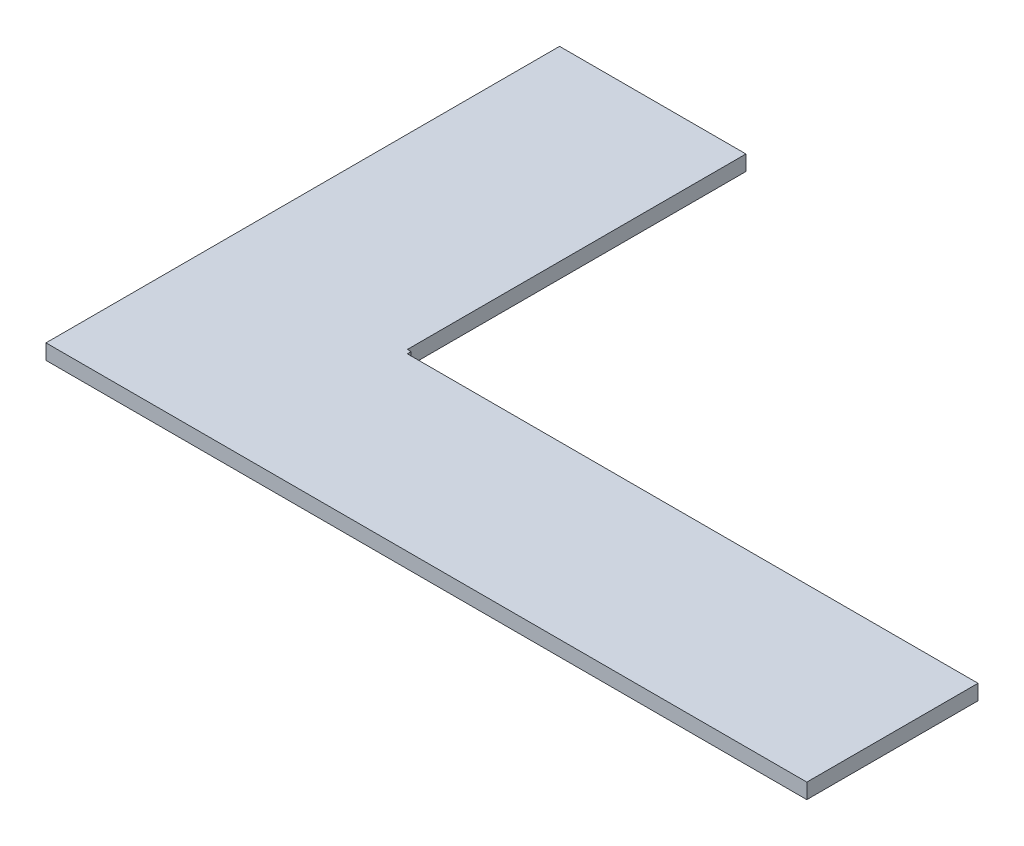
from build123d import *

# Parameters (mm, degrees)
STOCK_2D1LAYER_1_START       = -45
STOCK_2D1LAYER_1_OUTLINE_W   = 200
STOCK_2D1LAYER_1_OUTLINE_H   = 4
STOCK_2D1LAYER_1_DEPTH       = 45
STOCK_2D1LAYER_1_START_2     = -135
STOCK_2D1LAYER_1_2_OUTLINE_W = 50
STOCK_2D1LAYER_1_2_OUTLINE_H = 4
STOCK_2D1LAYER_1_2_DEPTH     = 90
SKETCH1_W                    = 89
SKETCH1_H                    = 4
CUT_EXTRUDE1_DEPTH           = 1


# Read off the part's stored shape, not the designer's step: Stock-2D1Layer-1
with BuildPart() as part:
    # Stock-2D1Layer-1 outline → Stock-2D1Layer-1 (new body)
    with BuildSketch(Plane.XY.offset(STOCK_2D1LAYER_1_START)):
        with Locations((100, 6)):
            Rectangle(STOCK_2D1LAYER_1_OUTLINE_W, STOCK_2D1LAYER_1_OUTLINE_H)
    extrude(amount=STOCK_2D1LAYER_1_DEPTH)

    # Stock-2D1Layer-1 2 outline → Stock-2D1Layer-1 2 (add)
    with BuildSketch(Plane.XY.offset(STOCK_2D1LAYER_1_START_2)):
        with Locations((25, 6)):
            Rectangle(STOCK_2D1LAYER_1_2_OUTLINE_W, STOCK_2D1LAYER_1_2_OUTLINE_H)
    extrude(amount=STOCK_2D1LAYER_1_2_DEPTH)

    # Sketch1 → Cut-Extrude1 (cut)
    with BuildSketch(Plane(origin=(50, 0, 0), x_dir=(0, 0, -1), z_dir=(1, 0, 0))):
        with Locations((90.5, 6)):
            Rectangle(SKETCH1_W, SKETCH1_H)
    extrude(amount=-CUT_EXTRUDE1_DEPTH, mode=Mode.SUBTRACT)


solid = part.part
